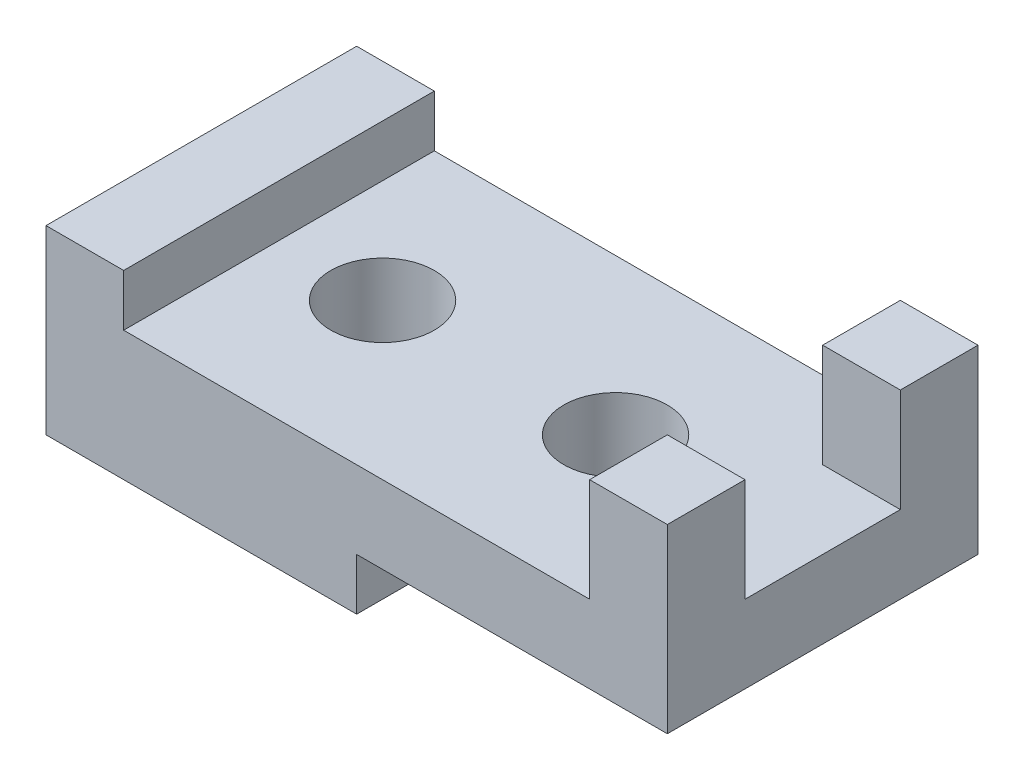
from build123d import *

# Parameters (mm, degrees)
BOSS_EXTRUDE1_DEPTH = 60
SKETCH2_R           = 10
CUT_EXTRUDE1_DEPTH  = 89.459030065
SKETCH3_W           = 30
SKETCH3_H           = 20
CUT_EXTRUDE2_DEPTH  = 15


with BuildPart() as part:
    # Sketch1 → Boss-Extrude1 (new body)
    with BuildSketch(Plane.XY):
        Polygon((-60, 7.5), (-60, -27.5), (0, -27.5), (0, -17.5), (60, -17.5), (60, 17.5), (45, 17.5), (45, -2.5), (-45, -2.5), (-45, 7.5), align=None)
    extrude(amount=-BOSS_EXTRUDE1_DEPTH)

    # Sketch2 → Cut-Extrude1 (cut, through all)
    with BuildSketch(Plane(origin=(0, -2.5, 0), x_dir=(1, 0, 0), z_dir=(0, 1, 0))):
        with Locations((-25, 30)):
            Circle(SKETCH2_R)
        with Locations((20, 30)):
            Circle(SKETCH2_R)
    extrude(amount=-CUT_EXTRUDE1_DEPTH, mode=Mode.SUBTRACT)

    # Sketch3 → Cut-Extrude2 (cut)
    with BuildSketch(Plane(origin=(60, 0, 0), x_dir=(0, 0, -1), z_dir=(1, 0, 0))):
        with Locations((30, 7.5)):
            Rectangle(SKETCH3_W, SKETCH3_H)
    extrude(amount=-CUT_EXTRUDE2_DEPTH, mode=Mode.SUBTRACT)


solid = part.part
